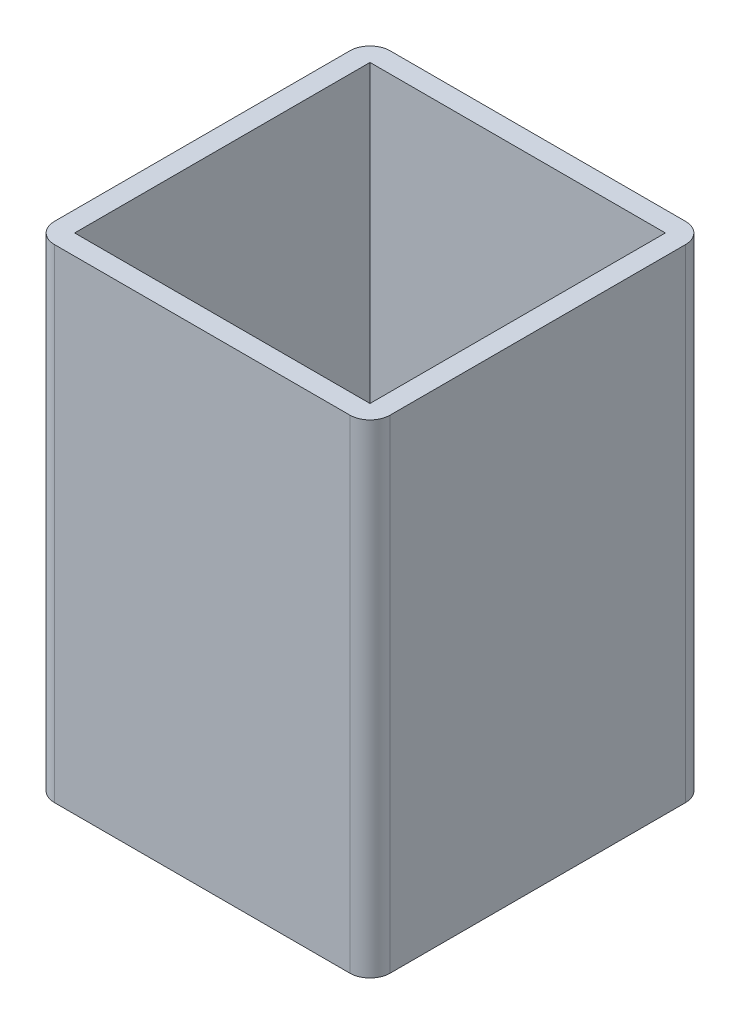
from build123d import *

# Parameters (mm, degrees)
SKETCH_1_W              = 50
SKETCH_1_H              = 72
STEPPER_COVER_DEPTH     = 50
FILLET_2_R              = 3
SHELL_START             = 3
SHELL_1_OUTLINE_W       = 69
SHELL_1_OUTLINE_H       = 44
SHELL_1_DEPTH           = 44
SKETCH_2_R              = 12
COUPLER_CLEARANCE_DEPTH = 3.1


# Read off the part's stored shape, not the designer's step: 抽壳1
with BuildPart() as part:
    # 草图1 → Stepper_cover (new body)
    with BuildSketch(Plane.XY):
        with Locations((25, 36)):
            Rectangle(SKETCH_1_W, SKETCH_1_H)
    extrude(amount=STEPPER_COVER_DEPTH)

    # Fillet 2
    fillet_2_edges = [part.edges().sort_by_distance(p)[0] for p in [
        (50, 36, 50),
        (0, 36, 50),
        (50, 36, 0),
        (0, 36, 0),
    ]]
    fillet(fillet_2_edges, radius=FILLET_2_R)

    # 抽壳1 outline → 抽壳1 (cut)
    with BuildSketch(Plane.YZ.offset(SHELL_START)):
        with Locations((37.5, 25)):
            Rectangle(SHELL_1_OUTLINE_W, SHELL_1_OUTLINE_H)
    extrude(amount=SHELL_1_DEPTH, mode=Mode.SUBTRACT)

    # 草图2 → Coupler_clearance (cut)
    with BuildSketch(Plane.XZ):
        with Locations(Location((25, 25, 0), (0, 0, 270))):
            Circle(SKETCH_2_R)
    extrude(amount=-COUPLER_CLEARANCE_DEPTH, mode=Mode.SUBTRACT)


solid = part.part
